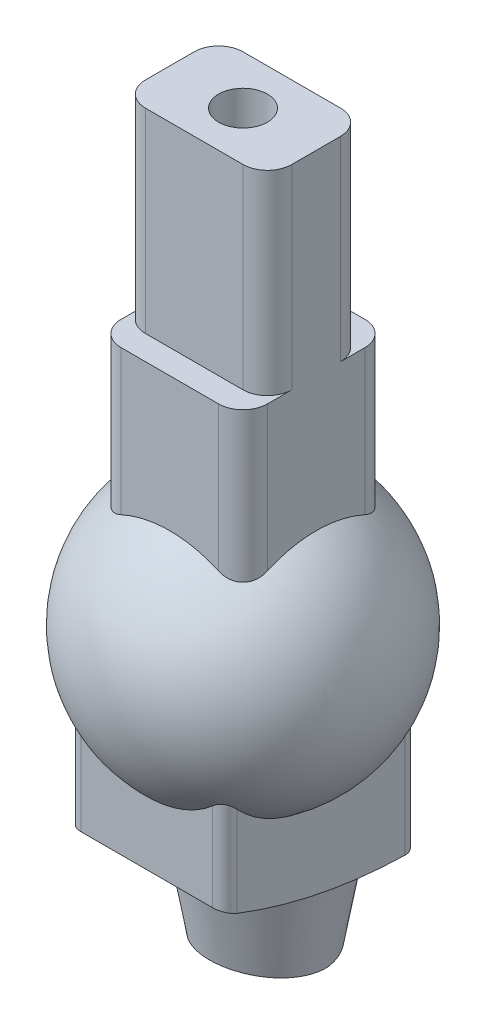
from build123d import *

# Parameters (mm, degrees)
BOSS_EXTRUDE1_DEPTH = 3.2
CUT_EXTRUDE1_START  = -2.25739
CUT_EXTRUDE1_DEPTH  = 4.51476888
SKETCH6_W           = 6
SKETCH6_H           = 16.9095993
BOSS_EXTRUDE2_DEPTH = 3
SKETCH7_OUTSIDE_W   = 20.212
SKETCH7_OUTSIDE_H   = 20.212
SKETCH7_OUTSIDE_W_2 = 6
SKETCH7_OUTSIDE_H_2 = 4
CUT_EXTRUDE2_DEPTH  = 8
FILLET1_R           = 1
FILLET2_R           = 0.5
SKETCH8_R           = 1
CUT_EXTRUDE3_DEPTH  = 14


# Read off the part's stored shape, not the designer's step: Cut-Extrude1
with BuildPart() as part:
    # Sketch1 → Revolve1 (revolve)
    with BuildSketch(Plane(origin=(0, 0, 0), x_dir=(1, 0, 0), z_dir=(0, 1, 0))):
        with BuildLine():
            Line((0, 5.7), (0, -5.7))
            ThreePointArc((0, -5.7), (5.7, 0), (0, 5.7))
        make_face()
    revolve(axis=Axis((0, 0, 14.54011976), (0, 0, -1)))

    # Sketch2 → Boss-Extrude1 (add, symmetric)
    with BuildSketch(Plane(origin=(0, 0, 0), x_dir=(0, 0, -1), z_dir=(1, 0, 0))):
        with BuildLine():
            Line((-3.95, 0), (3.95, 0))
            Line((3.95, 0), (3.95, -8.3))
            ThreePointArc((3.95, -8.3), (-0.079654203, -7.901360118), (-3.95, -6.710792959))
            Line((-3.95, -6.710792959), (-3.95, 0))
        make_face()
    extrude(amount=BOSS_EXTRUDE1_DEPTH, both=True)

    # Sketch3 → Revolve2 (revolve)
    with BuildSketch(Plane(origin=(0, 0, 0), x_dir=(0, 0, -1), z_dir=(1, 0, 0)), mode=Mode.PRIVATE) as revolve2_sk:
        Polygon((0.95, -7.401163559), (0.95, -11.652192734), (3.2, -11.652192734), (3.95, -7.401163559), align=None)
    revolve(revolve2_sk.sketch.rotate(Axis((0, -11.652192734, -0.95), (0, 1, 0)), 45.250719205), axis=Axis((0, -11.652192734, -0.95), (0, 1, 0)))

    # Cut-Extrude1 outline → Cut-Extrude1 (cut)
    with BuildSketch(Plane(origin=(0, 0, 0), x_dir=(0, 0, -1), z_dir=(1, 0, 0)).offset(CUT_EXTRUDE1_START)):
        with BuildLine():
            Line((-3, -11.652192734), (1.275092895, -11.652192734))
            ThreePointArc((1.275092895, -11.652192734), (-0.058768815, -11.464467118), (-1.379872872, -11.201575434))
            Line((-1.379872872, -11.201575434), (-3, -10.831225258))
            Line((-3, -10.831225258), (-3, -11.652192734))
        make_face()
    extrude(amount=CUT_EXTRUDE1_DEPTH, mode=Mode.SUBTRACT)

    # Sketch6 → Boss-Extrude2 (add, symmetric)
    with BuildSketch(Plane(origin=(0, 0, 0), x_dir=(0, 0, -1), z_dir=(1, 0, 0))):
        with Locations((0, 9.893007616)):
            Rectangle(SKETCH6_W, SKETCH6_H)
    extrude(amount=BOSS_EXTRUDE2_DEPTH, both=True)

    # Sketch7 outside → Cut-Extrude2 (cut)
    with BuildSketch(Plane(origin=(0, 18.347807266, 0), x_dir=(1, 0, 0), z_dir=(0, 1, 0))):
        Rectangle(SKETCH7_OUTSIDE_W, SKETCH7_OUTSIDE_H)
        Rectangle(SKETCH7_OUTSIDE_W_2, SKETCH7_OUTSIDE_H_2, mode=Mode.SUBTRACT)
    extrude(amount=-CUT_EXTRUDE2_DEPTH, mode=Mode.SUBTRACT)

    # Fillet1
    fillet1_edges = [part.edges().sort_by_distance(p)[0] for p in [
        (-3, 7.077190264, 3),
        (3, 7.077190264, 3),
        (-3, 7.077190264, -3),
        (3, 7.077190264, -3),
        (-3, 14.347807266, -2),
        (-3, 14.347807266, 2),
        (3, 14.347807266, -2),
        (3, 14.347807266, 2),
    ]]
    fillet(fillet1_edges, radius=FILLET1_R)

    # Fillet2
    fillet2_edges = [part.edges().sort_by_distance(p)[0] for p in [
        (-3.2, -4.644533788, 3.95),
        (3.2, -4.644533788, 3.95),
        (3.2, -5.439137308, -3.95),
        (-3.2, -5.439137308, -3.95),
    ]]
    fillet(fillet2_edges, radius=FILLET2_R)

    # Sketch8 → Cut-Extrude3 (cut)
    with BuildSketch(Plane(origin=(0, 18.347807266, 0), x_dir=(1, 0, 0), z_dir=(0, 1, 0))):
        with Locations(Location((0, 0, 0), (0, 0, 270))):
            Circle(SKETCH8_R)
    extrude(amount=-CUT_EXTRUDE3_DEPTH, mode=Mode.SUBTRACT)


solid = part.part
